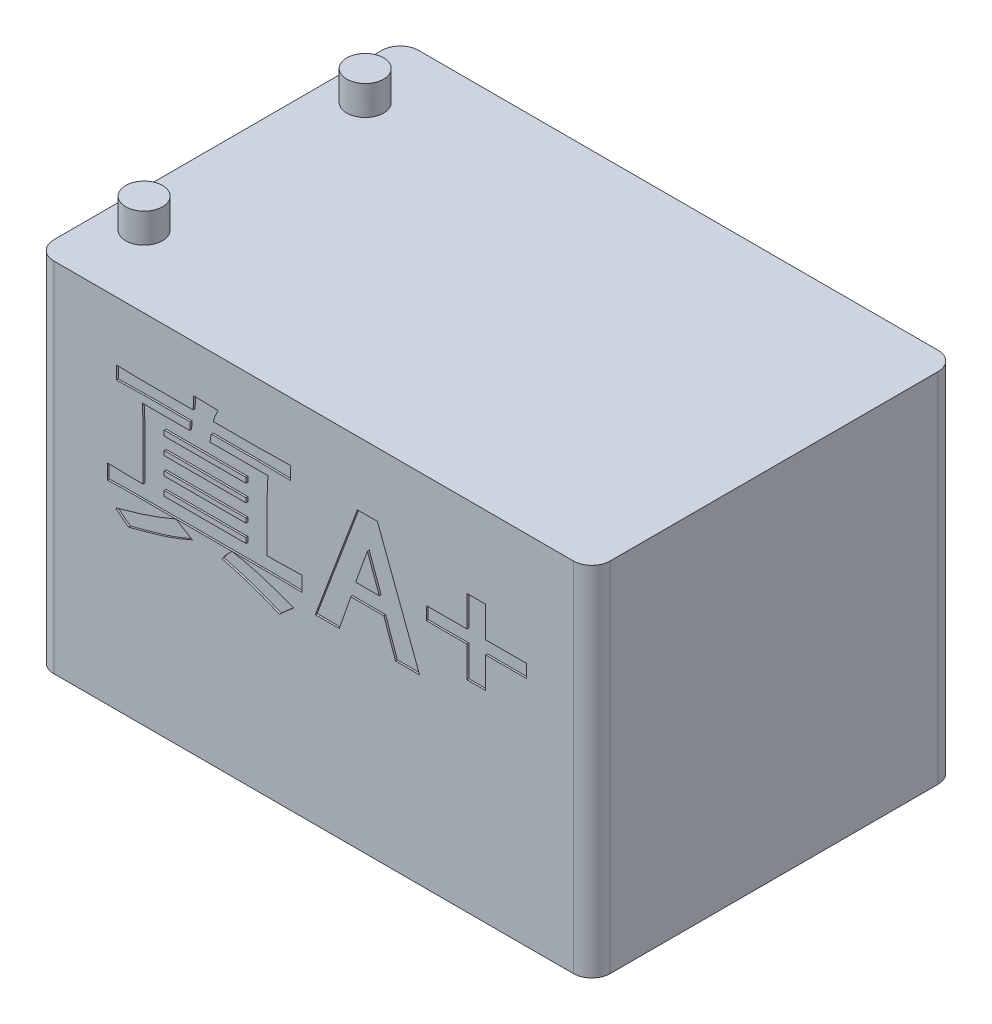
from build123d import *

# Parameters (mm, degrees)
SKETCH_1_W                = 151
SKETCH_1_H                = 97
EXTRUDE_1_DEPTH           = 99
SKETCH_3_R                = 5
EXTRUDE_4_DEPTH           = 8
FILLET_1_R                = 5
CUT_EXTRUDE_START         = -0.5
CUT_EXTRUDE_1_OUTLINE_W   = 22.202189311
CUT_EXTRUDE_1_OUTLINE_H   = 1.390856407
CUT_EXTRUDE_1_OUTLINE_H_2 = 1.223438506
CUT_EXTRUDE_1_OUTLINE_H_3 = 1.397295557
CUT_EXTRUDE_1_DEPTH       = 0.5


# Read off the part's stored shape, not the designer's step: 切除-拉伸1
with BuildPart() as part:
    # 草图1 → 凸台-拉伸1 (new body)
    with BuildSketch(Plane.XY):
        Rectangle(SKETCH_1_W, SKETCH_1_H)
    extrude(amount=EXTRUDE_1_DEPTH)

    # 草图3 → 凸台-拉伸4 (add)
    with BuildSketch(Plane(origin=(0, 48.5, 0), x_dir=(1, 0, 0), z_dir=(0, 1, 0))):
        with Locations(Location((-65.5, -19.5, 0), (0, 0, 90))):
            Circle(SKETCH_3_R)
        with Locations(Location((-65.5, -79.5, 0), (0, 0, 90))):
            Circle(SKETCH_3_R)
    extrude(amount=EXTRUDE_4_DEPTH)

    # 圆角1
    fillet_1_edges = [part.edges().sort_by_distance(p)[0] for p in [
        (-75.5, 0, 99),
        (75.5, 0, 99),
        (-75.5, 0, 0),
        (75.5, 0, 0),
    ]]
    fillet(fillet_1_edges, radius=FILLET_1_R)

    # 切除-拉伸1 outline → 切除-拉伸1 (cut)
    # profile 1 of 5: a face of its own
    with BuildSketch(Plane.XY.offset(99).offset(CUT_EXTRUDE_START)):
        with BuildLine():
            add(Edge.make_bspline(
                [(-32.543464263, 35.808113329), (-31.414647039, 35.758226427), (-29.200613679, 35.660379529), (-26.984498149, 35.642848951), (-25.898261429, 35.634256278)],
                knots=[0, 0, 0, 0, 0.509846529, 1, 1, 1, 1], degree=3))
            add(Edge.make_bspline(
                [(-32.723760464, 32.395363812), (-32.69635038, 32.635596208), (-32.638444037, 33.143109418), (-32.581620104, 33.95285198), (-32.551952983, 34.850597544), (-32.546375808, 35.479695097), (-32.543464263, 35.808113329)],
                knots=[0, 0, 0, 0, 0.212103251, 0.448087782, 0.711876108, 1, 1, 1, 1], degree=3))
            Line((-32.723760464, 32.395363812), (-46.329684482, 32.395363812))
            add(Edge.make_bspline(
                [(-53.502897618, 32.562781713), (-53.073601184, 32.550566857), (-52.25146418, 32.527174432), (-51.073379683, 32.483182519), (-50.006366856, 32.462491847), (-49.053501957, 32.43395224), (-48.214249232, 32.414796147), (-47.486621414, 32.401691534), (-46.870588646, 32.394209859), (-46.497103739, 32.395006643), (-46.329684482, 32.395363812)],
                knots=[0, 0, 0, 0, 0.179557884, 0.343867708, 0.492876974, 0.625738554, 0.742429752, 0.843850217, 0.930003916, 1, 1, 1, 1], degree=3))
            Line((-53.502897618, 32.562781713), (-53.502897618, 29.008370895))
            add(Edge.make_bspline(
                [(-46.104314231, 29.182227946), (-46.649510264, 29.179151739), (-47.787202871, 29.172732437), (-49.566591473, 29.137829769), (-51.487832842, 29.089011556), (-52.816112181, 29.035855288), (-53.502897618, 29.008370895)],
                knots=[0, 0, 0, 0, 0.22099458, 0.461162379, 0.721394574, 1, 1, 1, 1], degree=3))
            Line((-46.104314231, 29.182227946), (-33.444945267, 29.182227946))
            Line((-33.444945267, 29.182227946), (-33.638119768, 27.102382486))
            Line((-33.638119768, 27.102382486), (-46.516419833, 27.102382486))
            add(Edge.make_bspline(
                [(-46.291049581, 21.403734707), (-46.29316064, 21.837344844), (-46.297519696, 22.732692634), (-46.347364599, 24.115058785), (-46.41711118, 25.581226669), (-46.482655077, 26.585192358), (-46.516419833, 27.102382486)],
                knots=[0, 0, 0, 0, 0.228039069, 0.470870626, 0.727420477, 1, 1, 1, 1], degree=3))
            Line((-46.291049581, 21.403734707), (-46.291049581, 8.164842241))
            Line((-46.291049581, 8.164842241), (-48.808757244, 8.164842241))
            add(Edge.make_bspline(
                [(-55.98197038, 8.332260142), (-54.773705779, 8.285053374), (-52.383507442, 8.191668583), (-49.991557255, 8.173718441), (-48.808757244, 8.164842241)],
                knots=[0, 0, 0, 0, 0.505508092, 1, 1, 1, 1], degree=3))
            Line((-55.98197038, 8.332260142), (-55.98197038, 4.269156471))
            add(Edge.make_bspline(
                [(-45.653573728, 4.436574372), (-46.149393392, 4.437763005), (-47.121734406, 4.440094006), (-48.553339425, 4.423333737), (-49.927014854, 4.410441255), (-51.247158491, 4.401296122), (-52.50922688, 4.374116363), (-53.717529657, 4.339884594), (-54.868154062, 4.310592489), (-55.617107267, 4.282730051), (-55.98197038, 4.269156471)],
                knots=[0, 0, 0, 0, 0.143987021, 0.282369774, 0.415766173, 0.542929653, 0.665749089, 0.78235167, 0.893969547, 1, 1, 1, 1], degree=3))
            Line((-45.653573728, 4.436574372), (-14.552479073, 4.436574372))
            add(Edge.make_bspline(
                [(-3.135866066, 4.269156471), (-4.039473327, 4.293406794), (-5.878762901, 4.342768246), (-8.686139392, 4.405957801), (-11.58830114, 4.425239727), (-13.554413035, 4.432757893), (-14.552479073, 4.436574372)],
                knots=[0, 0, 0, 0, 0.237497047, 0.483424449, 0.737768478, 1, 1, 1, 1], degree=3))
            Line((-3.135866066, 4.269156471), (-3.135866066, 8.332260142))
            add(Edge.make_bspline(
                [(-10.04507405, 8.164842241), (-9.441924418, 8.167672846), (-8.25485927, 8.173243791), (-6.501161428, 8.206580428), (-4.801022823, 8.256200693), (-3.685282722, 8.307164409), (-3.135866066, 8.332260142)],
                knots=[0, 0, 0, 0, 0.261789059, 0.515229806, 0.761287759, 1, 1, 1, 1], degree=3))
            Line((-10.04507405, 8.164842241), (-12.601416613, 8.164842241))
            Line((-12.601416613, 8.164842241), (-12.601416613, 21.91242756))
            add(Edge.make_bspline(
                [(-12.376046362, 27.102382486), (-12.410307631, 26.69471423), (-12.480216885, 25.862877441), (-12.54759174, 24.589538462), (-12.596295402, 23.267175474), (-12.599688202, 22.36965547), (-12.601416613, 21.91242756)],
                knots=[0, 0, 0, 0, 0.236165048, 0.481888821, 0.736056143, 1, 1, 1, 1], degree=3))
            Line((-12.376046362, 27.102382486), (-28.151963941, 27.102382486))
            Line((-28.151963941, 27.102382486), (-27.765614939, 29.182227946))
            Line((-27.765614939, 29.182227946), (-15.003219575, 29.182227946))
            add(Edge.make_bspline(
                [(-6.291049581, 29.008370895), (-6.741804786, 29.020708023), (-7.6175794, 29.044677893), (-8.894426047, 29.08856865), (-10.096637461, 29.109298396), (-11.223377485, 29.137724978), (-12.275119012, 29.157649335), (-13.251790845, 29.167380097), (-14.153197284, 29.185454445), (-14.728474806, 29.183270817), (-15.003219575, 29.182227946)],
                knots=[0, 0, 0, 0, 0.155237253, 0.30161126, 0.439821557, 0.56916694, 0.689631864, 0.801957954, 0.905417796, 1, 1, 1, 1], degree=3))
            Line((-6.291049581, 29.008370895), (-6.291049581, 32.562781713))
            add(Edge.make_bspline(
                [(-15.003219575, 32.395363812), (-14.73062076, 32.39429896), (-14.161781104, 32.392076905), (-13.26896619, 32.410425745), (-12.298715674, 32.419317825), (-11.249236117, 32.44266958), (-10.12003759, 32.456689813), (-8.913989115, 32.494411211), (-7.628168761, 32.523323482), (-6.746068752, 32.54935415), (-6.291049581, 32.562781713)],
                knots=[0, 0, 0, 0, 0.093845007, 0.195829031, 0.307418314, 0.427885454, 0.55721844, 0.696187731, 0.843282615, 1, 1, 1, 1], degree=3))
            Line((-15.003219575, 32.395363812), (-27.250482936, 32.395363812))
            add(Edge.make_bspline(
                [(-25.898261429, 35.634256278), (-26.045593313, 35.361268361), (-26.333953091, 34.826973043), (-26.699181603, 34.010052882), (-27.01532018, 33.206524832), (-27.172933927, 32.662858266), (-27.250482936, 32.395363812)],
                knots=[0, 0, 0, 0, 0.264432084, 0.517549735, 0.762625148, 1, 1, 1, 1], degree=3))
        make_face()
        with Locations((-29.446233098, 8.860270444)):
            Rectangle(CUT_EXTRUDE_1_OUTLINE_W, CUT_EXTRUDE_1_OUTLINE_H, mode=Mode.SUBTRACT)
        with Locations((-29.446233098, 13.554410818)):
            Rectangle(CUT_EXTRUDE_1_OUTLINE_W, CUT_EXTRUDE_1_OUTLINE_H_2, mode=Mode.SUBTRACT)
        with Locations((-29.446233098, 18.332260142)):
            Rectangle(CUT_EXTRUDE_1_OUTLINE_W, CUT_EXTRUDE_1_OUTLINE_H_2, mode=Mode.SUBTRACT)
        with Locations((-29.446233098, 23.023180941)):
            Rectangle(CUT_EXTRUDE_1_OUTLINE_W, CUT_EXTRUDE_1_OUTLINE_H_3, mode=Mode.SUBTRACT)
    # profile 2 of 5: a face of its own
    with BuildSketch(Plane.XY.offset(99).offset(CUT_EXTRUDE_START)):
        with BuildLine():
            add(Edge.make_bspline(
                [(-24.880875724, 1.352221507), (-24.667106461, 1.63790599), (-24.245337273, 2.201564725), (-23.566621348, 2.997747431), (-22.851371765, 3.732190575), (-22.348457707, 4.185909187), (-22.09916291, 4.410817772)],
                knots=[0, 0, 0, 0, 0.258309915, 0.5096484, 0.75693242, 1, 1, 1, 1], degree=3))
            add(Edge.make_bspline(
                [(-9.278815196, -3.92144237), (-9.993973276, -3.610367673), (-11.414217513, -2.992599298), (-13.560572626, -2.145290669), (-15.696473166, -1.36426101), (-17.469932214, -0.778222238), (-18.856372537, -0.337799776), (-19.850850143, -0.035138888), (-20.80007495, 0.246478151), (-21.70349874, 0.511182802), (-22.558736907, 0.758075805), (-23.373174418, 0.975853538), (-24.140793234, 1.176706626), (-24.640259862, 1.295158051), (-24.880875724, 1.352221507)],
                knots=[0, 0, 0, 0, 0.141873816, 0.281749554, 0.419733138, 0.555564403, 0.621511707, 0.684385034, 0.744677103, 0.801641444, 0.855654481, 0.906615709, 0.955012526, 1, 1, 1, 1], degree=3))
            add(Edge.make_bspline(
                [(-5.389568577, -0.508692853), (-5.598119537, -0.682132416), (-6.003394238, -1.019175542), (-6.586710844, -1.515978598), (-7.136174943, -1.976750593), (-7.64093206, -2.41890402), (-8.107218761, -2.832630957), (-8.53187623, -3.22169927), (-8.923267309, -3.574798972), (-9.163592206, -3.809105072), (-9.278815196, -3.92144237)],
                knots=[0, 0, 0, 0, 0.157227581, 0.305538565, 0.444132641, 0.572877667, 0.694487556, 0.805462176, 0.906729472, 1, 1, 1, 1], degree=3))
            add(Edge.make_bspline(
                [(-22.09916291, 4.410817772), (-21.400677236, 4.286745001), (-20.018598561, 4.041244859), (-17.978371928, 3.593702523), (-15.99168957, 3.087157323), (-14.026875747, 2.507961214), (-12.02883323, 1.855235152), (-9.923565128, 1.151294334), (-7.699746632, 0.346832102), (-6.174760792, -0.217913736), (-5.389568577, -0.508692853)],
                knots=[0, 0, 0, 0, 0.121962004, 0.241323611, 0.359022123, 0.47439629, 0.593434002, 0.720402317, 0.856039369, 1, 1, 1, 1], degree=3))
        make_face()
    # profile 3 of 5: a face of its own
    with BuildSketch(Plane.XY.offset(99).offset(CUT_EXTRUDE_START)):
        with BuildLine():
            add(Edge.make_bspline(
                [(-37.379265937, 4.410817772), (-36.637912833, 3.96218593), (-35.147603732, 3.060321335), (-33.641588393, 2.184935494), (-32.884739214, 1.745009659)],
                knots=[0, 0, 0, 0, 0.497449223, 1, 1, 1, 1], degree=3))
            add(Edge.make_bspline(
                [(-53.728267869, -1.120412106), (-53.242888685, -0.990568075), (-52.296671115, -0.737444936), (-50.919622232, -0.349676146), (-49.617190609, 0.025259229), (-48.389360537, 0.380686125), (-47.239039634, 0.74039824), (-46.162326424, 1.077387848), (-45.159219222, 1.406119818), (-43.347591682, 2.038856501), (-40.746473147, 3.001902188), (-38.490176219, 3.945987808), (-37.379265937, 4.410817772)],
                knots=[0, 0, 0, 0, 0.087247083, 0.17008295, 0.248412637, 0.322597162, 0.392034582, 0.457692092, 0.518509162, 0.57532288, 0.790905987, 1, 1, 1, 1], degree=3))
            add(Edge.make_bspline(
                [(-50.231809401, -3.92144237), (-50.827895711, -3.480129618), (-52.028980031, -2.590906332), (-53.159043674, -1.612995454), (-53.728267869, -1.120412106)],
                knots=[0, 0, 0, 0, 0.496290144, 1, 1, 1, 1], degree=3))
            add(Edge.make_bspline(
                [(-32.884739214, 1.745009659), (-33.565270714, 1.441934518), (-34.935827532, 0.831556158), (-37.044979665, -0.004248051), (-39.215332905, -0.77602504), (-42.161945134, -1.713512721), (-45.838054624, -2.766820677), (-48.781599271, -3.540345982), (-50.231809401, -3.92144237)],
                knots=[0, 0, 0, 0, 0.122287859, 0.246281707, 0.372331269, 0.500368649, 0.753844248, 1, 1, 1, 1], degree=3))
        make_face()
    # profile 4 of 5: a face of its own
    with BuildSketch(Plane.XY.offset(99).offset(CUT_EXTRUDE_START)):
        Polygon((28.750804894, 0.856406954), (17.314874437, 31.197681906), (11.867353509, 31.197681906), (0.470057952, 0.856406954), (6.967160335, 0.856406954), (10.122343851, 9.896973599), (19.066323245, 9.896973599), (22.221506761, 0.856406954), align=None)
        Polygon((17.823567289, 13.96651642), (11.397295557, 13.96651642), (14.595542008, 22.828696529), align=None, mode=Mode.SUBTRACT)
    # profile 5 of 5: a face of its own
    with BuildSketch(Plane.XY.offset(99).offset(CUT_EXTRUDE_START)):
        Polygon((57.746297489, 14.507405023), (57.746297489, 18.06181584), (46.703155184, 18.06181584), (46.703155184, 26.419832582), (41.635544108, 26.419832582), (41.635544108, 18.06181584), (30.592401803, 18.06181584), (30.592401803, 14.507405023), (41.635544108, 14.507405023), (41.635544108, 6.142949131), (46.703155184, 6.142949131), (46.703155184, 14.507405023), align=None)
    extrude(amount=CUT_EXTRUDE_1_DEPTH, mode=Mode.SUBTRACT)


solid = part.part
